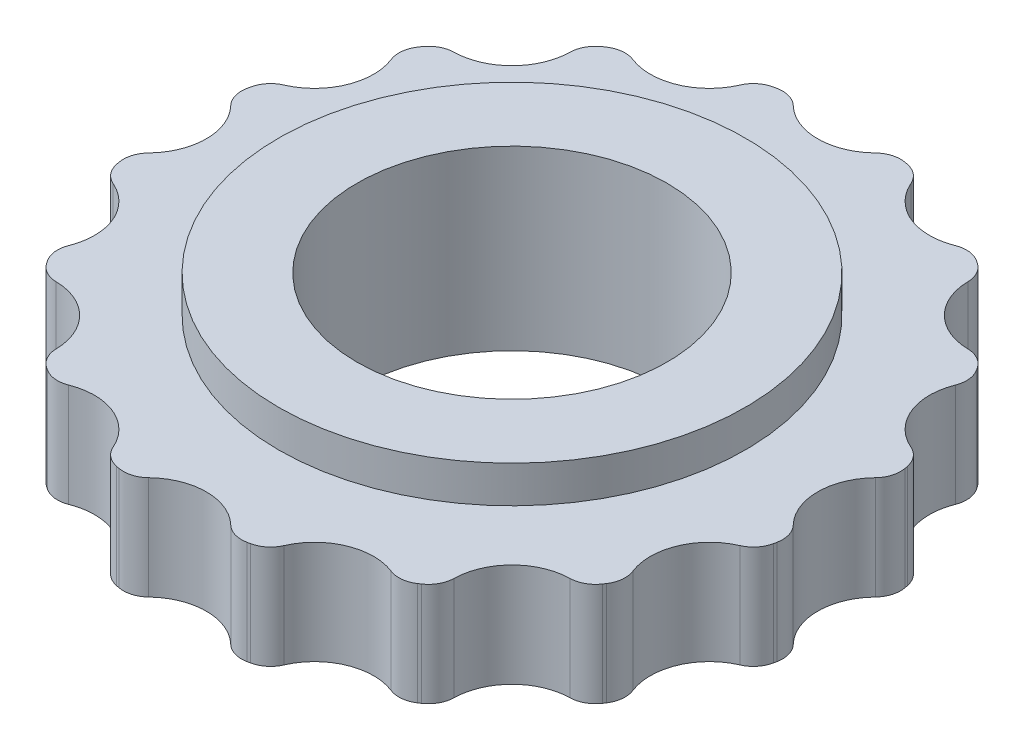
from build123d import *

# Parameters (mm, degrees)
SKETCH1_R           = 22.7
SKETCH1_R_2         = 10.5
BOSS_EXTRUDE1_DEPTH = 6
SKETCH2_OUTSIDE_W   = 60.464
SKETCH2_OUTSIDE_H   = 60.464
SKETCH2_OUTSIDE_R   = 15.8
CUT_EXTRUDE1_DEPTH  = 2.5
FILLET1_R           = 6
CUT_EXTRUDE2_DEPTH  = 34.478799262
CIRPATTERN1_COUNT   = 16


with BuildPart() as part:
    # Sketch1 → Boss-Extrude1 (new, symmetric)
    with BuildSketch(Plane(origin=(0, 0, 0), x_dir=(1, 0, 0), z_dir=(0, 1, 0))):
        with Locations(Location((0, 0, 0), (0, 0, 270))):
            Circle(SKETCH1_R)
        with Locations(Location((0, 0, 0), (0, 0, 270))):
            Circle(SKETCH1_R_2, mode=Mode.SUBTRACT)
    extrude(amount=BOSS_EXTRUDE1_DEPTH, both=True)

    # Sketch2 outside → Cut-Extrude1 (cut)
    with BuildSketch(Plane(origin=(0, 6, 0), x_dir=(1, 0, 0), z_dir=(0, 1, 0))):
        Rectangle(SKETCH2_OUTSIDE_W, SKETCH2_OUTSIDE_H)
        with Locations(Location((0, 0, 0), (0, 0, 270))):
            Circle(SKETCH2_OUTSIDE_R, mode=Mode.SUBTRACT)
    cut_extrude1 = extrude(amount=-CUT_EXTRUDE1_DEPTH, mode=Mode.SUBTRACT)

    # Mirror1: Cut-Extrude1 across plane
    add(cut_extrude1.mirror(Plane.ZX), mode=Mode.SUBTRACT)

    # Fillet1
    # the kernel refuses this fillet: 6 mm, written as the material it adds along each edge
    with BuildSketch(Plane(origin=(0, -3.5, 0), x_dir=(0, 0, 1), z_dir=(-1, 0, 0))) as fillet1_piece_1:
        with BuildLine():
            CenterArc((20.673397172, -6), FILLET1_R, 90, 54.314665287)
            Line((15.8, -2.5), (15.702532057, -2.43))
            ThreePointArc((15.702532057, -2.43), (15.68, -1.25), (15.68, 0))
            Line((15.68, 0), (15.8, 0.12))
            Line((15.8, 0.12), (20.673397172, 0.12))
            Line((20.673397172, 0.12), (20.673397172, 0))
        make_face()
    revolve(axis=Axis((0, -3.5, 0), (0, 1, 0)))

    # Sketch3 → Cut-Extrude2 (cut, through all)
    with BuildSketch(Plane.XZ.offset(3.5)):
        with BuildLine():
            ThreePointArc((-2.779777309, 21.823745819), (0, 20.7), (2.779777309, 21.823745819))
            ThreePointArc((2.779777309, 21.823745819), (3.498507516, 22.243201944), (4.329718774, 22.283256839))
            ThreePointArc((4.329718774, 22.283256839), (0, 22.7), (-4.329718774, 22.283256839))
            ThreePointArc((-4.329718774, 22.283256839), (-3.498507516, 22.243201944), (-2.779777309, 21.823745819))
        make_face()
    cut_extrude2 = extrude(amount=-CUT_EXTRUDE2_DEPTH, mode=Mode.SUBTRACT)

    # CirPattern1: Cut-Extrude2 ×16 about axis
    cirpattern1_axis = Axis((0, 0, 0), (0, 1, 0))
    for i in range(1, CIRPATTERN1_COUNT):
        add(cut_extrude2.rotate(cirpattern1_axis, i * 360 / CIRPATTERN1_COUNT), mode=Mode.SUBTRACT)


solid = part.part
